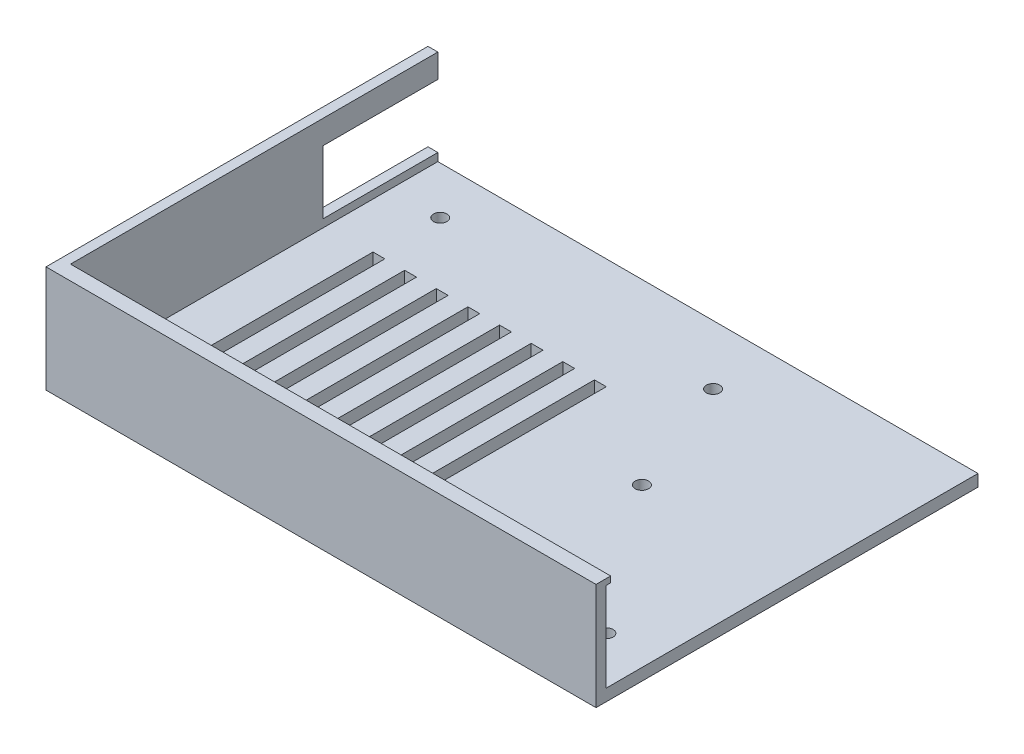
from build123d import *

# Parameters (mm, degrees)
SKETCH1_W                     = 278.2
SKETCH1_H                     = 193.2
SHELL_BLOCK_DEPTH             = 27
SKETCH2_W                     = 273.2
SKETCH2_H                     = 185.8
FRONT_OPENING_DEPTH           = 1.5
SKETCH3_W                     = 273.2
SKETCH3_H                     = 188.2
DISPLAY_POCKET_DEPTH          = 22.5
SKETCH4_W                     = 3
SKETCH4_H                     = 56
VENT_SLOTS_DEPTH              = 4
SKETCH5_W                     = 58
SKETCH5_H                     = 16
CABLE_EXIT_X_SHORT_SIDE_DEPTH = 140.1
SKETCH6_R                     = 1.7
BOLT_HOLES_DEPTH              = 4
KEEP_ONE_HALF_X_DEPTH         = 172.491603293
KEEP_ONE_HALF_X_DEPTH_BACK    = 172.491603293
SKETCH7_W                     = 200
SKETCH7_H                     = 400
KEEP_ONE_QUARTER_Z_DEPTH      = 172.491603293
KEEP_ONE_QUARTER_Z_DEPTH_BACK = 172.491603293
SKETCH8_W                     = 400
SKETCH8_H                     = 200


with BuildPart() as part:
    # Sketch1 → Shell Block (new body)
    with BuildSketch(Plane(origin=(0, 0, 0), x_dir=(1, 0, 0), z_dir=(0, 1, 0))):
        Rectangle(SKETCH1_W, SKETCH1_H)
    extrude(amount=SHELL_BLOCK_DEPTH)

    # Sketch2 → Front Opening (cut)
    with BuildSketch(Plane(origin=(0, 27, 0), x_dir=(1, 0, 0), z_dir=(0, 1, 0))):
        Rectangle(SKETCH2_W, SKETCH2_H)
    extrude(amount=-FRONT_OPENING_DEPTH, mode=Mode.SUBTRACT)

    # Sketch3 → Display Pocket (cut)
    with BuildSketch(Plane(origin=(0, 25.5, 0), x_dir=(1, 0, 0), z_dir=(0, 1, 0))):
        Rectangle(SKETCH3_W, SKETCH3_H)
    extrude(amount=-DISPLAY_POCKET_DEPTH, mode=Mode.SUBTRACT)

    # Sketch4 → Vent Slots (cut)
    with BuildSketch(Plane(origin=(0, 3, 0), x_dir=(1, 0, 0), z_dir=(0, 1, 0))):
        with Locations((-67.5, 56)):
            Rectangle(SKETCH4_W, SKETCH4_H)
        with Locations((-67.5, -56)):
            Rectangle(SKETCH4_W, SKETCH4_H)
        with Locations((-75.5, 56)):
            Rectangle(SKETCH4_W, SKETCH4_H)
        with Locations((-75.5, -56)):
            Rectangle(SKETCH4_W, SKETCH4_H)
        with Locations((-83.5, 56)):
            Rectangle(SKETCH4_W, SKETCH4_H)
        with Locations((-83.5, -56)):
            Rectangle(SKETCH4_W, SKETCH4_H)
        with Locations((-91.5, 56)):
            Rectangle(SKETCH4_W, SKETCH4_H)
        with Locations((-91.5, -56)):
            Rectangle(SKETCH4_W, SKETCH4_H)
        with Locations((-99.5, 56)):
            Rectangle(SKETCH4_W, SKETCH4_H)
        with Locations((-99.5, -56)):
            Rectangle(SKETCH4_W, SKETCH4_H)
        with Locations((-107.5, 56)):
            Rectangle(SKETCH4_W, SKETCH4_H)
        with Locations((-107.5, -56)):
            Rectangle(SKETCH4_W, SKETCH4_H)
        with Locations((-115.5, 56)):
            Rectangle(SKETCH4_W, SKETCH4_H)
        with Locations((-115.5, -56)):
            Rectangle(SKETCH4_W, SKETCH4_H)
        with Locations((-123.5, 56)):
            Rectangle(SKETCH4_W, SKETCH4_H)
        with Locations((-123.5, -56)):
            Rectangle(SKETCH4_W, SKETCH4_H)
    extrude(amount=-VENT_SLOTS_DEPTH, mode=Mode.SUBTRACT)

    # Sketch5 → Cable Exit (-X short side) (cut)
    with BuildSketch(Plane(origin=(0, 0, 0), x_dir=(0, 0, -1), z_dir=(1, 0, 0))):
        with Locations((0, 13)):
            Rectangle(SKETCH5_W, SKETCH5_H)
    extrude(amount=-CABLE_EXIT_X_SHORT_SIDE_DEPTH, mode=Mode.SUBTRACT)

    # Sketch6 → Bolt Holes (cut)
    with BuildSketch(Plane(origin=(0, 3, 0), x_dir=(1, 0, 0), z_dir=(0, 1, 0))):
        with Locations((-40, -45)):
            Circle(SKETCH6_R)
        with Locations((-40, 45)):
            Circle(SKETCH6_R)
        with Locations((40, -45)):
            Circle(SKETCH6_R)
        with Locations((40, 45)):
            Circle(SKETCH6_R)
        with Locations((-52, -15)):
            Circle(SKETCH6_R)
        with Locations((-52, 15)):
            Circle(SKETCH6_R)
        with Locations((52, -15)):
            Circle(SKETCH6_R)
        with Locations((52, 15)):
            Circle(SKETCH6_R)
        with Locations((-12, -82)):
            Circle(SKETCH6_R)
        with Locations((-12, 82)):
            Circle(SKETCH6_R)
        with Locations((12, -82)):
            Circle(SKETCH6_R)
        with Locations((12, 82)):
            Circle(SKETCH6_R)
        with Locations((-124, -12)):
            Circle(SKETCH6_R)
        with Locations((-124, 12)):
            Circle(SKETCH6_R)
        with Locations((124, -12)):
            Circle(SKETCH6_R)
        with Locations((124, 12)):
            Circle(SKETCH6_R)
    extrude(amount=-BOLT_HOLES_DEPTH, mode=Mode.SUBTRACT)

    # Sketch7 → Keep one half (X) (cut, two sides: drawn at the far end of the back side and taken through both)
    with BuildSketch(Plane(origin=(0, 0, 0), x_dir=(1, 0, 0), z_dir=(0, 1, 0)).offset(-KEEP_ONE_HALF_X_DEPTH_BACK)):
        with Locations((100, 0)):
            Rectangle(SKETCH7_W, SKETCH7_H)
    extrude(amount=KEEP_ONE_HALF_X_DEPTH + KEEP_ONE_HALF_X_DEPTH_BACK, mode=Mode.SUBTRACT)

    # Sketch8 → Keep one quarter (Z) (cut, two sides: drawn at the far end of the back side and taken through both)
    with BuildSketch(Plane(origin=(0, 0, 0), x_dir=(1, 0, 0), z_dir=(0, 1, 0)).offset(-KEEP_ONE_QUARTER_Z_DEPTH_BACK)):
        with Locations((0, 100)):
            Rectangle(SKETCH8_W, SKETCH8_H)
    extrude(amount=KEEP_ONE_QUARTER_Z_DEPTH + KEEP_ONE_QUARTER_Z_DEPTH_BACK, mode=Mode.SUBTRACT)


solid = part.part
